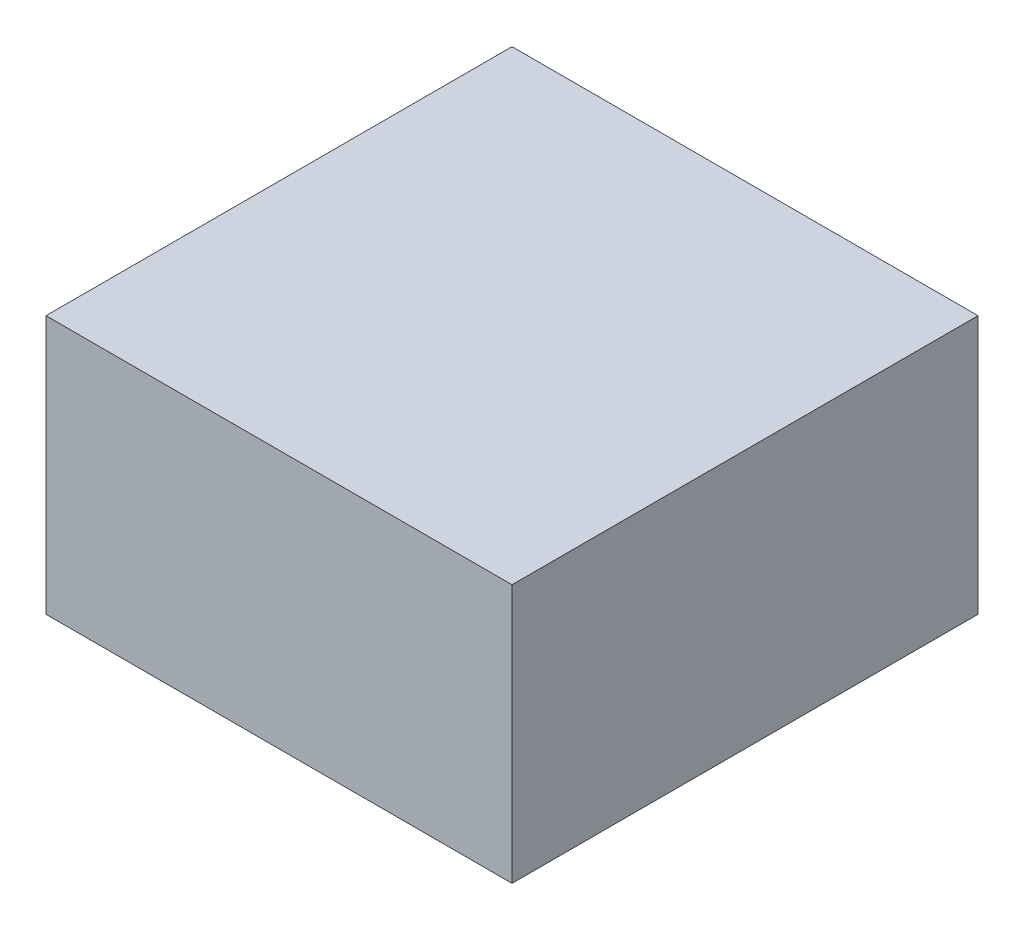
from build123d import *

# Parameters (mm, degrees)
SKETCH1_W           = 546
SKETCH1_H           = 546
SKETCH1_W_2         = 540
SKETCH1_H_2         = 540
BOSS_EXTRUDE1_DEPTH = 300
SKETCH2_W           = 546
SKETCH2_H           = 546
BOSS_EXTRUDE2_DEPTH = 3


with BuildPart() as part:
    # Sketch1 → Boss-Extrude1 (new body)
    with BuildSketch(Plane(origin=(0, 0, 0), x_dir=(1, 0, 0), z_dir=(0, 1, 0))):
        Rectangle(SKETCH1_W, SKETCH1_H)
        Rectangle(SKETCH1_W_2, SKETCH1_H_2, mode=Mode.SUBTRACT)
    extrude(amount=BOSS_EXTRUDE1_DEPTH)

    # Sketch2 → Boss-Extrude2 (add)
    with BuildSketch(Plane(origin=(0, 300, 0), x_dir=(1, 0, 0), z_dir=(0, 1, 0))):
        Rectangle(SKETCH2_W, SKETCH2_H)
    extrude(amount=BOSS_EXTRUDE2_DEPTH)


solid = part.part
